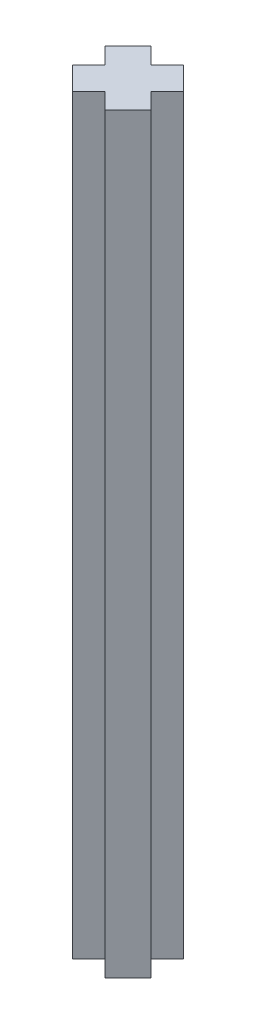
from build123d import *

# Parameters (mm, degrees)
BOSS_EXTRUDE1_DEPTH = 82.826086957
SCALE1_SCALE        = 0.92


with BuildPart() as part:
    # Sketch1 → Boss-Extrude1 (new body)
    with BuildSketch(Plane(origin=(0, 0, 0), x_dir=(1, 0, 0), z_dir=(0, 1, 0))):
        Polygon((-0.6269783, 2.91618698), (-2.423029524, 4.712238204), (-4.963029524, 2.172238204), (-3.1669783, 0.37618698), (-4.963029524, -1.419864244), (-2.423029524, -3.959864244), (-0.6269783, -2.16381302), (1.169072924, -3.959864244), (3.709072924, -1.419864244), (1.9130217, 0.37618698), (3.709072924, 2.172238204), (1.169072924, 4.712238204), align=None)
    extrude(amount=BOSS_EXTRUDE1_DEPTH)


with BuildPart() as part_1:
    # Scale1: scaled about (-0.6269783, 41.413043478, -0.37618698)
    add(part.part.scale(SCALE1_SCALE).moved(Location((-0.050158264, 3.313043478, -0.030094958))))


solid = part_1.part
